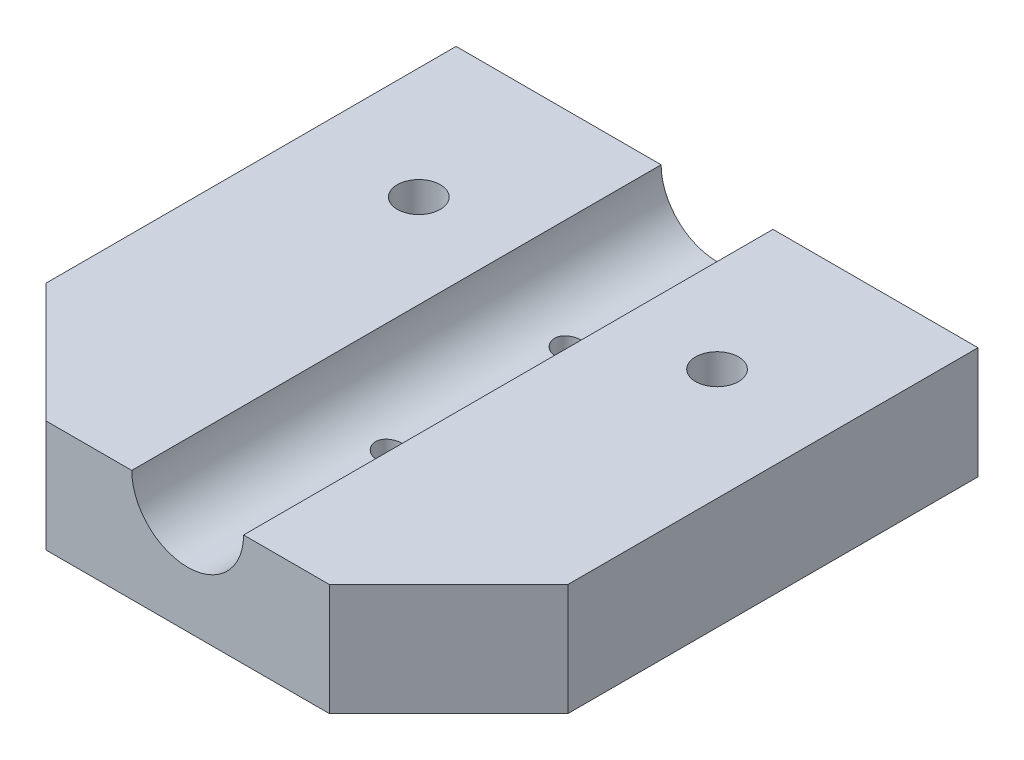
from build123d import *

# Parameters (mm, degrees)
SKETCH1_W                                     = 44.45
SKETCH1_H                                     = 45.085
BOSS_EXTRUDE1_DEPTH                           = 9.525
SKETCH4_R                                     = 4.7625
CUT_EXTRUDE1_DEPTH                            = 52.159881499
MOTORHOLES_D                                  = 2.2606
MOTORHOLES_DEPTH                              = 6.35
MOTORHOLES_TIP                                = 0.679152758
CBORE_FOR_6_SOCKET_HEAD_CAP_SCREW1_AT_2_COUNT = 2
CBORE_FOR_6_SOCKET_HEAD_CAP_SCREW1_AT_2_PITCH = 25.4
CHAMFER1_SIZE                                 = 10.16
F_4_40_TAPPED_HOLE1_D                         = 2.2606


with BuildPart() as part:
    # Sketch1 → Boss-Extrude1 (new body)
    with BuildSketch(Plane(origin=(0, 0, 0), x_dir=(1, 0, 0), z_dir=(0, 1, 0))):
        Rectangle(SKETCH1_W, SKETCH1_H)
    extrude(amount=BOSS_EXTRUDE1_DEPTH)

    # Sketch4 → Cut-Extrude1 (cut, through all)
    with BuildSketch(Plane.XY.offset(22.5425)):
        with Locations((0, 9.525)):
            Circle(SKETCH4_R)
    extrude(amount=-CUT_EXTRUDE1_DEPTH, mode=Mode.SUBTRACT)

    # MotorHoles
    with Locations(Plane(origin=(0, 0, 0), x_dir=(-1, 0, 0), z_dir=(0, -1, 0))):
        with Locations((-5.715, -19.3675), (5.715, -19.3675), (13.081, 19.6469), (-13.081, 19.6469)):
            Hole(MOTORHOLES_D / 2, depth=MOTORHOLES_DEPTH)
            with Locations((0, 0, -(MOTORHOLES_DEPTH + MOTORHOLES_TIP / 2))):  # 118° drill point
                Cone(0, MOTORHOLES_D / 2, MOTORHOLES_TIP, mode=Mode.SUBTRACT)

    # Sketch5 → CBORE for #6 Socket Head Cap Screw1 (revolve, cut)
    with BuildSketch(Plane(origin=(12.7, 0, -9.8425), x_dir=(0, 0, -1), z_dir=(1, 0, 0))):
        Polygon((0, 0), (0, 9.525), (1.8288, 9.525), (1.8288, 3.5052), (3.57251, 3.5052), (3.57251, 0.635), (4.20751, 0), align=None)
    cbore_for_6_socket_head_cap_screw1 = revolve(axis=Axis((12.7, -6.35, -9.8425), (0, 1, 0)), mode=Mode.SUBTRACT)

    # CBORE for #6 Socket Head Cap Screw1 at 2: CBORE for #6 Socket Head Cap Screw1 ×2
    with Locations(*[(-i * CBORE_FOR_6_SOCKET_HEAD_CAP_SCREW1_AT_2_PITCH, 0, 0) for i in range(1, CBORE_FOR_6_SOCKET_HEAD_CAP_SCREW1_AT_2_COUNT)]):
        add(cbore_for_6_socket_head_cap_screw1, mode=Mode.SUBTRACT)

    # Chamfer1
    chamfer1_edges = [part.edges().sort_by_distance(p)[0] for p in [
        (22.225, 4.7625, 22.5425),
        (-22.225, 4.7625, 22.5425),
    ]]
    chamfer(chamfer1_edges, length=CHAMFER1_SIZE)

    # #4-40 Tapped Hole1 (through all)
    with Locations(Plane(origin=(0, 0, 0), x_dir=(-1, 0, 0), z_dir=(0, -1, 0))):
        with Locations((0, 9.8425), (0, -5.3975)):
            Hole(F_4_40_TAPPED_HOLE1_D / 2)


solid = part.part
